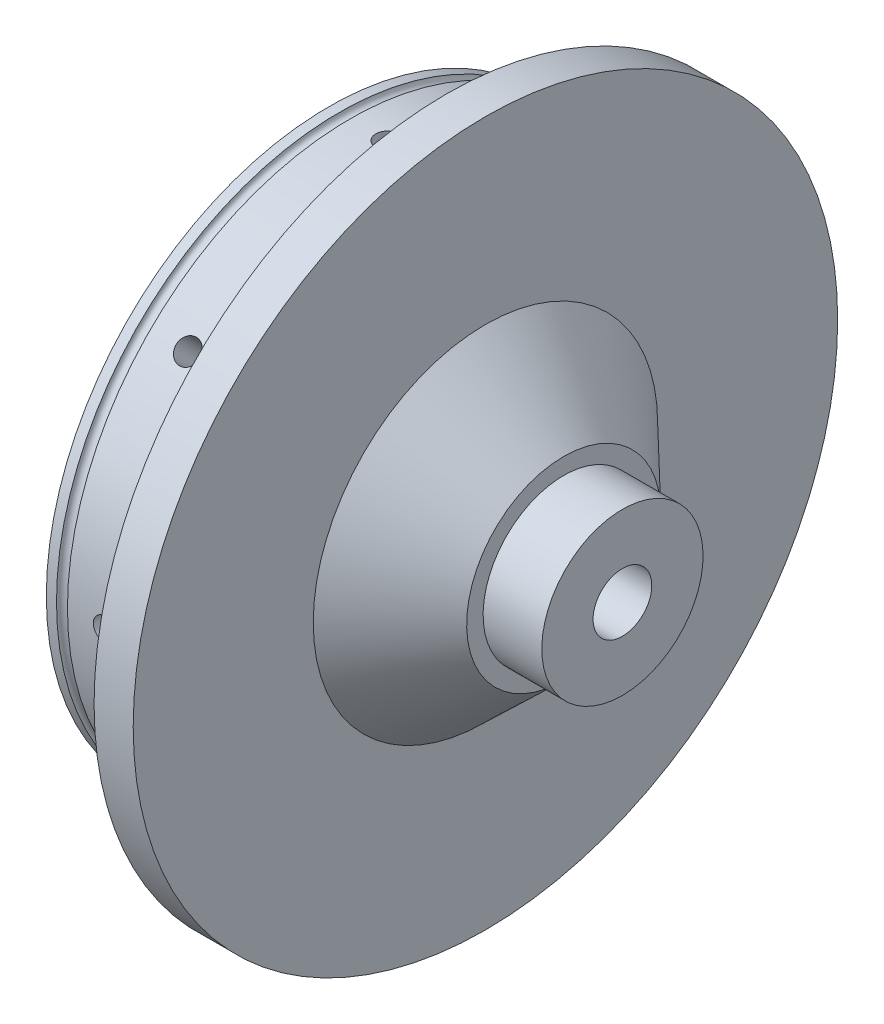
from build123d import *

# Parameters (mm, degrees)
SKETCH1_R           = 57.15
BOSS_EXTRUDE1_DEPTH = 6.35
SKETCH2_R           = 45.847
BOSS_EXTRUDE2_DEPTH = 19.05
SKETCH3_R           = 38.227
CUT_EXTRUDE1_DEPTH  = 6.35
SKETCH5_R           = 0.889
SKETCH6_R           = 1.905
CUT_EXTRUDE3_DEPTH  = 6.35
CIRPATTERN1_COUNT   = 8
SKETCH10_R          = 1.1303
CUT_EXTRUDE5_DEPTH  = 5.08
SKETCH18_R          = 13.081
BOSS_EXTRUDE6_DEPTH = 9.525
SKETCH19_R          = 4.7625
CUT_EXTRUDE7_DEPTH  = 94.810370562


with BuildPart() as part:
    # Sketch1 → Boss-Extrude1 (new body)
    with BuildSketch(Plane(origin=(0, 0, 0), x_dir=(0, 0, -1), z_dir=(1, 0, 0))):
        Circle(SKETCH1_R)
    extrude(amount=BOSS_EXTRUDE1_DEPTH)

    # Sketch2 → Boss-Extrude2 (add)
    with BuildSketch(Plane.ZY):
        Circle(SKETCH2_R)
    extrude(amount=BOSS_EXTRUDE2_DEPTH)

    # Sketch3 → Cut-Extrude1 (cut)
    with BuildSketch(Plane.ZY.offset(19.05)):
        Circle(SKETCH3_R)
    extrude(amount=-CUT_EXTRUDE1_DEPTH, mode=Mode.SUBTRACT)

    # Sketch5 → Cut-Revolve1 (revolve, cut)
    with BuildSketch(Plane.XY):
        with Locations((-16.51, 45.847)):
            Circle(SKETCH5_R)
    revolve(axis=Axis((0, 0, 0), (-1, 0, 0)), mode=Mode.SUBTRACT)

    # Sketch6 → Cut-Extrude3 (cut)
    with BuildSketch(Plane.XY.offset(45.847)):
        with Locations((-9.525, 0)):
            Circle(SKETCH6_R)
    cut_extrude3 = extrude(amount=-CUT_EXTRUDE3_DEPTH, mode=Mode.SUBTRACT)

    # CirPattern1: Cut-Extrude3 ×8 about axis
    cirpattern1_axis = Axis((-19.05, 0, 0), (1, 0, 0))
    for i in range(1, CIRPATTERN1_COUNT):
        add(cut_extrude3.rotate(cirpattern1_axis, i * 360 / CIRPATTERN1_COUNT), mode=Mode.SUBTRACT)

    # Sketch10 → Cut-Extrude5 (cut)
    with BuildSketch(Plane.ZY.offset(12.7)):
        with Locations((0, 33.3375)):
            Circle(SKETCH10_R)
        with Locations((23.573172318, 23.573172318)):
            Circle(SKETCH10_R)
        with Locations((33.3375, 0)):
            Circle(SKETCH10_R)
        with Locations((23.573172318, -23.573172318)):
            Circle(SKETCH10_R)
        with Locations((0, -33.3375)):
            Circle(SKETCH10_R)
        with Locations((-23.573172318, -23.573172318)):
            Circle(SKETCH10_R)
        with Locations((-33.3375, 0)):
            Circle(SKETCH10_R)
        with Locations((-23.573172318, 23.573172318)):
            Circle(SKETCH10_R)
    extrude(amount=-CUT_EXTRUDE5_DEPTH, mode=Mode.SUBTRACT)

    # Sketch17 → Revolve1 (revolve)
    with BuildSketch(Plane.XY):
        Polygon((19.05, 0), (6.35, 0), (6.35, 27.94), (19.05, 15.748), align=None)
    revolve(axis=Axis((19.05, 0, 0), (-1, 0, 0)))

    # Sketch18 → Boss-Extrude6 (add)
    with BuildSketch(Plane(origin=(19.05, 0, 0), x_dir=(0, 0, -1), z_dir=(1, 0, 0))):
        Circle(SKETCH18_R)
    extrude(amount=BOSS_EXTRUDE6_DEPTH)

    # Sketch19 → Cut-Extrude7 (cut, through all)
    with BuildSketch(Plane(origin=(28.575, 0, 0), x_dir=(0, 0, -1), z_dir=(1, 0, 0))):
        Circle(SKETCH19_R)
    extrude(amount=-CUT_EXTRUDE7_DEPTH, mode=Mode.SUBTRACT)

    # Sketch20 → Cut-Revolve2 (revolve, cut)
    with BuildSketch(Plane.XY):
        with BuildLine():
            Line((19.05, 4.7625), (-12.7, 4.7625))
            Line((-12.7, 4.7625), (-12.7, 30.1625))
            Line((-12.7, 30.1625), (-4.572, 30.1625))
            ThreePointArc((-4.572, 30.1625), (-3.135159021, 29.567340979), (-2.54, 28.1305))
            Line((-2.54, 28.1305), (-2.54, 24.0665))
            Line((-2.54, 24.0665), (19.05, 4.7625))
        make_face()
    revolve(axis=Axis((0, 0, 0), (-1, 0, 0)), mode=Mode.SUBTRACT)


solid = part.part
